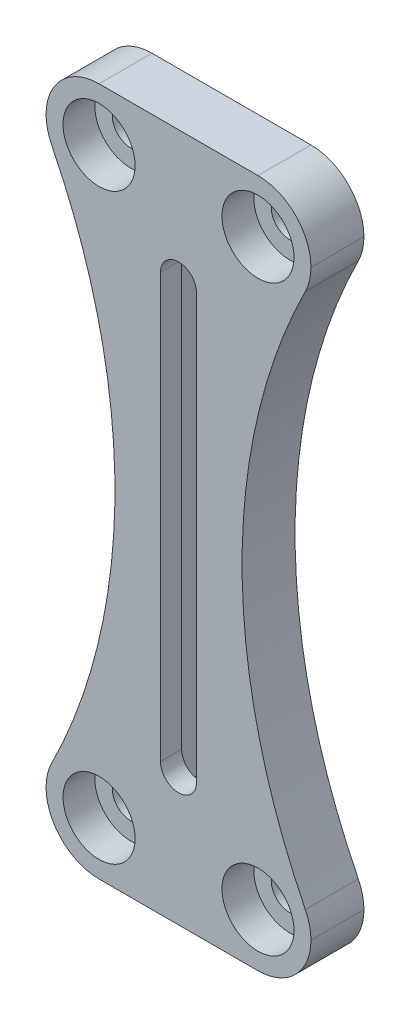
from build123d import *

# Parameters (mm, degrees)
ESBO_O1_W                  = 25
ESBO_O1_H                  = 65
ESBO_O1_R                  = 1.75
RESSALTO_EXTRUS_O1_DEPTH   = 5
CORTE_EXTRUS_O3_DEPTH      = 36.178118199
CORTE_EXTRUS_O3_DEPTH_BACK = 36.178118199
FILETE1_R                  = 5
ESBO_O2_R                  = 3.4
CORTE_EXTRUS_O1_DEPTH      = 3
ESBO_O3_W                  = 5.6
ESBO_O3_H                  = 48
CORTE_EXTRUS_O2_DEPTH      = 3


with BuildPart() as part:
    # Esboço1 → Ressalto-extrusão1 (new body)
    with BuildSketch(Plane.XY):
        Rectangle(ESBO_O1_W, ESBO_O1_H)
        with Locations((7.5, 27.5)):
            Circle(ESBO_O1_R, mode=Mode.SUBTRACT)
        with Locations(Location((7.5, -27.5, 0), (0, 0, 180))):
            Circle(ESBO_O1_R, mode=Mode.SUBTRACT)
        with Locations((-7.5, -27.5)):
            Circle(ESBO_O1_R, mode=Mode.SUBTRACT)
        with Locations(Location((-7.5, 27.5, 0), (0, 0, 180))):
            Circle(ESBO_O1_R, mode=Mode.SUBTRACT)
        with BuildLine():
            Line((-1.7, -20), (-1.7, 20))
            ThreePointArc((-1.7, 20), (0, 21.7), (1.7, 20))
            Line((1.7, 20), (1.7, -20))
            ThreePointArc((1.7, -20), (0, -21.7), (-1.7, -20))
        make_face(mode=Mode.SUBTRACT)
    extrude(amount=RESSALTO_EXTRUS_O1_DEPTH)

    # Esboço4 → Corte-extrusão3 (cut, two sides: drawn at the far end of the back side and taken through both)
    with BuildSketch(Plane.XY.offset(5).offset(-CORTE_EXTRUS_O3_DEPTH_BACK)):
        with BuildLine():
            Line((12.5, 27.5), (12.5, -27.5))
            ThreePointArc((12.5, -27.5), (12.365923064, -26.34987273), (11.970882905, -25.261427677))
            ThreePointArc((11.970882905, -25.261427677), (6, 0), (11.970882905, 25.261427677))
            ThreePointArc((11.970882905, 25.261427677), (12.365923064, 26.34987273), (12.5, 27.5))
        make_face()
        with BuildLine():
            Line((-12.5, 27.5), (-12.5, -27.5))
            ThreePointArc((-12.5, -27.5), (-12.365923064, -26.34987273), (-11.970882905, -25.261427677))
            ThreePointArc((-11.970882905, -25.261427677), (-6, 0), (-11.970882905, 25.261427677))
            ThreePointArc((-11.970882905, 25.261427677), (-12.365923064, 26.34987273), (-12.5, 27.5))
        make_face()
    extrude(amount=CORTE_EXTRUS_O3_DEPTH + CORTE_EXTRUS_O3_DEPTH_BACK, mode=Mode.SUBTRACT)

    # Filete1
    filete1_edges = [part.edges().sort_by_distance(p)[0] for p in [
        (-12.5, -32.5, 2.5),
        (12.5, -32.5, 2.5),
        (12.5, 32.5, 2.5),
        (-12.5, 32.5, 2.5),
    ]]
    fillet(filete1_edges, radius=FILETE1_R - 0.0001)  # a hair under: the kernel refuses the full size

    # Esboço2 → Corte-extrusão1 (cut)
    with BuildSketch(Plane.XY.offset(5)):
        with Locations((7.5, 27.5)):
            Circle(ESBO_O2_R)
        with Locations((-7.5, 27.5)):
            Circle(ESBO_O2_R)
        with Locations((-7.5, -27.5)):
            Circle(ESBO_O2_R)
        with Locations((7.5, -27.5)):
            Circle(ESBO_O2_R)
    extrude(amount=-CORTE_EXTRUS_O1_DEPTH, mode=Mode.SUBTRACT)

    # Esboço3 → Corte-extrusão2 (cut)
    with BuildSketch(Plane(origin=(0, 0, 0), x_dir=(-1, 0, 0), z_dir=(0, 0, -1))):
        Rectangle(ESBO_O3_W, ESBO_O3_H)
    extrude(amount=-CORTE_EXTRUS_O2_DEPTH, mode=Mode.SUBTRACT)


solid = part.part
